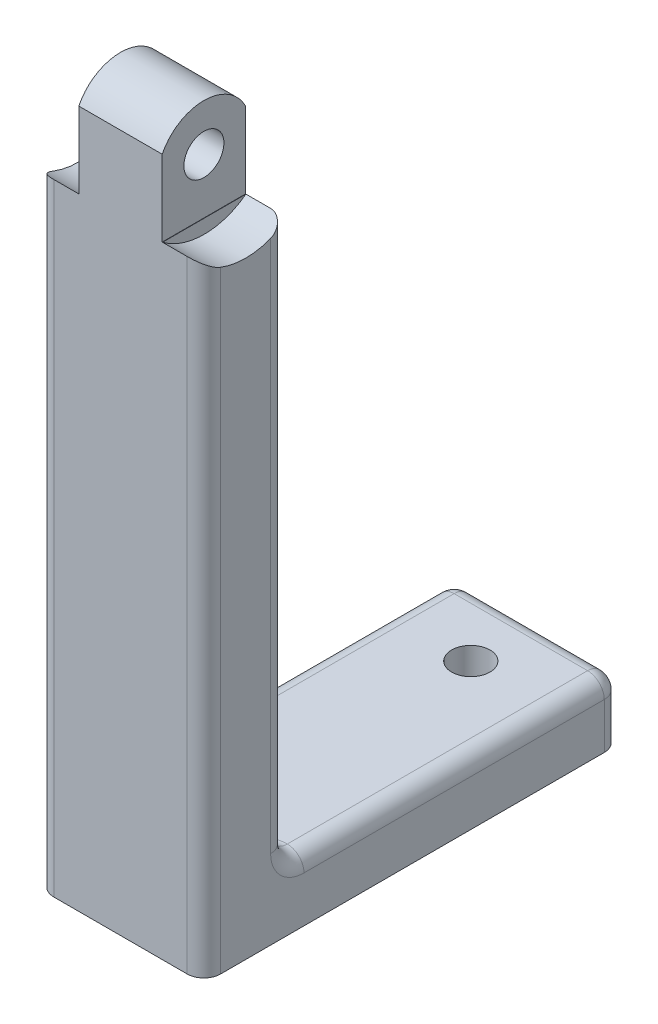
from build123d import *

# Parameters (mm, degrees)
BOSS_EXTRUDE1_DEPTH = 12.7
SKETCH4_R           = 1.4605
CUT_EXTRUDE1_DEPTH  = 62.237182332
SKETCH7_W           = 3.175
SKETCH7_H           = 8.255
CUT_EXTRUDE3_DEPTH  = 63.399049722
SKETCH8_R           = 1.524
CUT_EXTRUDE4_DEPTH  = 12.7
CUT_EXTRUDE5_DEPTH  = 3.1496
CUT_EXTRUDE6_DEPTH  = 65.699146295
CUT_EXTRUDE7_DEPTH  = 3.81
FILLET2_R           = 1.27


with BuildPart() as part:
    # Sketch3 → Boss-Extrude1 (new body)
    with BuildSketch(Plane(origin=(0, 0, 0), x_dir=(0, 0, -1), z_dir=(1, 0, 0))):
        Polygon((0, 0), (31.75, 0), (31.75, 4.7625), (6.35, 4.7625), (6.35, 55.5625), (0, 55.5625), align=None)
    extrude(amount=BOSS_EXTRUDE1_DEPTH)

    # Sketch4 → Cut-Extrude1 (cut, through all)
    with BuildSketch(Plane(origin=(0, 4.7625, 0), x_dir=(1, 0, 0), z_dir=(0, 1, 0))):
        with Locations(Location((6.35, 26.67, 0), (0, 0, 270))):
            Circle(SKETCH4_R)
        with Locations(Location((6.35, 7.874, 0), (0, 0, 270))):
            Circle(SKETCH4_R)
    extrude(amount=-CUT_EXTRUDE1_DEPTH, mode=Mode.SUBTRACT)

    # Sketch7 → Cut-Extrude3 (cut, through all)
    with BuildSketch(Plane(origin=(0, 0, -6.35), x_dir=(-1, 0, 0), z_dir=(0, 0, -1))):
        with Locations((-11.1125, 51.435)):
            Rectangle(SKETCH7_W, SKETCH7_H)
        with Locations((-1.5875, 51.435)):
            Rectangle(SKETCH7_W, SKETCH7_H)
    extrude(amount=-CUT_EXTRUDE3_DEPTH, mode=Mode.SUBTRACT)

    # Sketch8 → Cut-Extrude4 (cut)
    with BuildSketch(Plane(origin=(9.525, 0, 0), x_dir=(0, 0, -1), z_dir=(1, 0, 0))):
        with Locations(Location((3.175, 51.4985, 0), (0, 0, 90))):
            Circle(SKETCH8_R)
    extrude(amount=-CUT_EXTRUDE4_DEPTH, mode=Mode.SUBTRACT)

    # Sketch9 → Cut-Extrude5 (cut)
    with BuildSketch(Plane(origin=(12.7, 0, 0), x_dir=(0, 0, -1), z_dir=(1, 0, 0))):
        with BuildLine():
            Line((0, 47.3075), (6.35, 47.3075))
            ThreePointArc((6.35, 47.3075), (3.175, 46.240638648), (0, 47.3075))
        make_face()
    cut_extrude5 = extrude(amount=-CUT_EXTRUDE5_DEPTH, mode=Mode.SUBTRACT)

    # Mirror1: Cut-Extrude5 across plane
    add(cut_extrude5.mirror(Plane(origin=(6.35, 0, 0), x_dir=(0, 0, 1), z_dir=(1, 0, 0))), mode=Mode.SUBTRACT)

    # Sketch10 → Cut-Extrude6 (cut, through all)
    with BuildSketch(Plane(origin=(9.525, 0, 0), x_dir=(0, 0, -1), z_dir=(1, 0, 0))):
        with BuildLine():
            Line((0, 53.099909067), (0, 55.639909067))
            Line((0, 55.639909067), (6.35, 55.639909067))
            Line((6.35, 55.639909067), (6.35, 53.099909067))
            ThreePointArc((6.35, 53.099909067), (3.175, 55.0545), (0, 53.099909067))
        make_face()
    extrude(amount=-CUT_EXTRUDE6_DEPTH, mode=Mode.SUBTRACT)

    # Sketch11 → Cut-Extrude7 (cut)
    with BuildSketch(Plane(origin=(0, 0, -6.35), x_dir=(-1, 0, 0), z_dir=(0, 0, -1))):
        Polygon((-6.35, 23.8125), (-10.16, 23.8125), (-10.16, 4.7625), (-2.54, 4.7625), (-2.54, 23.8125), align=None)
    extrude(amount=-CUT_EXTRUDE7_DEPTH, mode=Mode.SUBTRACT)

    # Fillet2
    fillet2_edges = [part.edges().sort_by_distance(p)[0] for p in [
        (12.7, 2.38125, -31.75),
        (10.16, 4.7625, -4.445),
        (6.35, 23.8125, -2.54),
        (2.54, 14.2875, -6.35),
        (6.35, 23.8125, -6.35),
        (10.16, 14.2875, -6.35),
        (11.43, 4.7625, -6.35),
        (6.35, 4.7625, -31.75),
        (12.7, 4.7625, -19.05),
        (12.7, 26.035, -6.35),
        (12.7, 23.65375, 0),
        (0, 23.65375, 0),
        (0, 26.035, -6.35),
        (0, 4.7625, -19.05),
        (0, 2.38125, -31.75),
        (1.27, 4.7625, -6.35),
        (2.54, 14.2875, -2.54),
        (6.35, 4.7625, -2.54),
        (2.54, 4.7625, -4.445),
        (10.16, 14.2875, -2.54),
    ]]
    fillet(fillet2_edges, radius=FILLET2_R - 0.0001)  # a hair under: the kernel refuses the full size


solid = part.part
